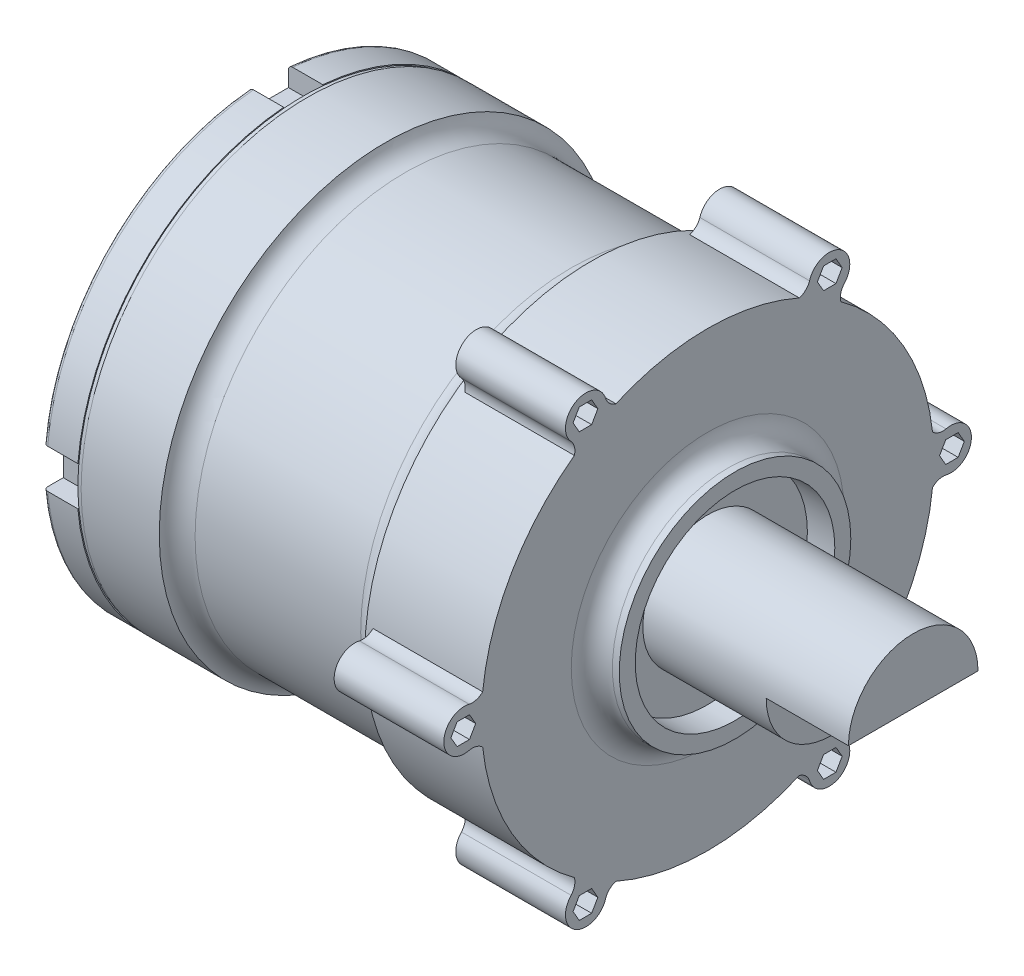
from build123d import *

# Parameters (mm, degrees)
SKETCH1_R            = 16.5
BOSS_EXTRUDE1_DEPTH  = 32
SKETCH2_W            = 2.99551857
SKETCH2_H            = 2.853303302
SKETCH2_W_2          = 2.853303302
SKETCH2_H_2          = 2.99551857
CUT_EXTRUDE1_DEPTH   = 2.5
SKETCH3_R            = 4
BOSS_EXTRUDE2_DEPTH  = 2.2
CUT_EXTRUDE2_DEPTH   = 12.2
SKETCH5_W            = 3.219111416
SKETCH5_H            = 1.024262723
BOSS_EXTRUDE3_DEPTH  = 3
CUT_EXTRUDE3_DEPTH   = 3
CIRPATTERN2_COUNT    = 2
SHELL1_START         = 2
SHELL1_DEPTH         = 30
SHELL1_START_2       = 14.2
SHELL1_2_DEPTH       = 17.8
SHELL1_START_3       = 4.5
SHELL1_3_DEPTH       = 9.7
SHELL1_START_4       = -0.2
SHELL1_4_OUTLINE_R   = 2
SHELL1_4_DEPTH       = 2.2
SKETCH7_R            = 9.780494134
CUT_EXTRUDE4_DEPTH   = 28
SKETCH8_R            = 16.5
SKETCH8_R_2          = 16.427034369
CUT_EXTRUDE5_DEPTH   = 0.3
FILLET1_R            = 0.3
FILLET2_R            = 0.8
BOSS_EXTRUDE5_START  = -25
SKETCH11_R           = 14.5
SKETCH11_R_2         = 4.725
BOSS_EXTRUDE5_DEPTH  = 25
SKETCH13_R           = 4.725
BOSS_EXTRUDE7_DEPTH  = 15
SKETCH15_R           = 8.446832145
SKETCH15_R_2         = 7.280611869
BOSS_EXTRUDE9_DEPTH  = 2
FILLET3_R            = 1.5
SKETCH16_R           = 17.509088537
SKETCH16_R_2         = 15.346804342
CUT_EXTRUDE6_DEPTH   = 7.5
FILLET4_R            = 1.5
CUT_EXTRUDE9_DEPTH   = 6
BOSS_EXTRUDE10_DEPTH = 8


# Read off the part's stored shape, not the designer's step: Shell1
with BuildPart() as part:
    # Sketch1 → Boss-Extrude1 (new body)
    with BuildSketch(Plane(origin=(0, 0, 0), x_dir=(0, 0, -1), z_dir=(1, 0, 0))):
        Circle(SKETCH1_R)
    extrude(amount=BOSS_EXTRUDE1_DEPTH)

    # Sketch2 → Cut-Extrude1 (cut)
    with BuildSketch(Plane.ZY):
        with Locations((-16.5, 0)):
            Rectangle(SKETCH2_W, SKETCH2_H)
        with Locations((0, 16.5)):
            Rectangle(SKETCH2_W_2, SKETCH2_H_2)
        with Locations((16.5, 0)):
            Rectangle(SKETCH2_W, SKETCH2_H)
        with Locations((0, -16.5)):
            Rectangle(SKETCH2_W_2, SKETCH2_H_2)
    extrude(amount=-CUT_EXTRUDE1_DEPTH, mode=Mode.SUBTRACT)

    # Sketch3 → Boss-Extrude2 (add)
    with BuildSketch(Plane.ZY):
        Circle(SKETCH3_R)
    extrude(amount=BOSS_EXTRUDE2_DEPTH)

    # Sketch4 → Cut-Extrude2 (cut)
    with BuildSketch(Plane.ZY):
        with BuildLine():
            ThreePointArc((2.706980055, 5.596864168), (0.036580812, 6.702979752), (-2.633818432, 5.596864168))
            ThreePointArc((-2.633818432, 5.596864168), (-2.633818432, 4.865247937), (-1.902202201, 4.865247937))
            ThreePointArc((-1.902202201, 4.865247937), (0.036580812, 5.668318155), (1.975363824, 4.865247937))
            ThreePointArc((1.975363824, 4.865247937), (2.706980055, 4.865247937), (2.706980055, 5.596864168))
        make_face()
        with BuildLine():
            ThreePointArc((-2.706980055, -5.596864168), (-0.036580812, -6.702979752), (2.633818432, -5.596864168))
            ThreePointArc((2.633818432, -5.596864168), (2.633818432, -4.865247937), (1.902202201, -4.865247937))
            ThreePointArc((1.902202201, -4.865247937), (-0.036580812, -5.668318155), (-1.975363824, -4.865247937))
            ThreePointArc((-1.975363824, -4.865247937), (-2.706980055, -4.865247937), (-2.706980055, -5.596864168))
        make_face()
    extrude(amount=-CUT_EXTRUDE2_DEPTH, mode=Mode.SUBTRACT)

    # Sketch5 → Boss-Extrude3 (add)
    with BuildSketch(Plane.ZY):
        with Locations((0, 11.230309148)):
            Rectangle(SKETCH5_W, SKETCH5_H)
    boss_extrude3 = extrude(amount=BOSS_EXTRUDE3_DEPTH)

    # Sketch6 → Cut-Extrude3 (cut)
    with BuildSketch(Plane(origin=(0, 11.742440509, 0), x_dir=(1, 0, 0), z_dir=(0, 1, 0))):
        with BuildLine():
            Line((-1.239883538, -0.443858464), (-2.275602474, -0.443858464))
            ThreePointArc((-2.275602474, -0.443858464), (-2.719460937, 0), (-2.275602474, 0.443858464))
            Line((-2.275602474, 0.443858464), (-1.239883538, 0.443858464))
            ThreePointArc((-1.239883538, 0.443858464), (-0.796025074, 0), (-1.239883538, -0.443858464))
        make_face()
    cut_extrude3 = extrude(amount=-CUT_EXTRUDE3_DEPTH, mode=Mode.SUBTRACT)

    # CirPattern2: Boss-Extrude3, Cut-Extrude3 ×2 about axis
    cirpattern2_axis = Axis((0, 0, 0), (1, 0, 0))
    add([boss_extrude3.rotate(cirpattern2_axis, i * 360 / CIRPATTERN2_COUNT) for i in range(1, CIRPATTERN2_COUNT)])
    add([cut_extrude3.rotate(cirpattern2_axis, i * 360 / CIRPATTERN2_COUNT) for i in range(1, CIRPATTERN2_COUNT)], mode=Mode.SUBTRACT)

    # Shell1 outline → Shell1 (cut)
    with BuildSketch(Plane.YZ.offset(SHELL1_START)):
        with BuildLine():
            Line((13.002240715, 3.426651651), (14.089288785, 3.426651651))
            ThreePointArc((14.089288785, 3.426651651), (10.253048327, 10.253048327), (3.426651651, 14.089288785))
            Line((3.426651651, 14.089288785), (3.426651651, 13.002240715))
            Line((3.426651651, 13.002240715), (-3.426651651, 13.002240715))
            Line((-3.426651651, 13.002240715), (-3.426651651, 14.089288785))
            ThreePointArc((-3.426651651, 14.089288785), (-10.253048327, 10.253048327), (-14.089288785, 3.426651651))
            Line((-14.089288785, 3.426651651), (-13.002240715, 3.426651651))
            Line((-13.002240715, 3.426651651), (-13.002240715, -3.426651651))
            Line((-13.002240715, -3.426651651), (-14.089288785, -3.426651651))
            ThreePointArc((-14.089288785, -3.426651651), (-10.253048327, -10.253048327), (-3.426651651, -14.089288785))
            Line((-3.426651651, -14.089288785), (-3.426651651, -13.002240715))
            Line((-3.426651651, -13.002240715), (3.426651651, -13.002240715))
            Line((3.426651651, -13.002240715), (3.426651651, -14.089288785))
            ThreePointArc((3.426651651, -14.089288785), (10.253048327, -10.253048327), (14.089288785, -3.426651651))
            Line((14.089288785, -3.426651651), (13.002240715, -3.426651651))
            Line((13.002240715, -3.426651651), (13.002240715, 3.426651651))
        make_face()
        with BuildLine():
            ThreePointArc((-3.451034375, 0.487988639), (-3.668318155, -0.036580811), (-3.451034375, -0.561150262))
            ThreePointArc((-3.451034375, -0.561150262), (-3.451034375, -4.121193617), (-7.01107773, -4.121193617))
            ThreePointArc((-7.01107773, -4.121193617), (-8.702979752, -0.036580811), (-7.01107773, 4.048031994))
            ThreePointArc((-7.01107773, 4.048031994), (-3.451034375, 4.048031994), (-3.451034375, 0.487988639))
        make_face(mode=Mode.SUBTRACT)
        with BuildLine():
            ThreePointArc((3.451034375, -0.487988639), (3.668318155, 0.036580811), (3.451034375, 0.561150262))
            ThreePointArc((3.451034375, 0.561150262), (3.451034375, 4.121193617), (7.01107773, 4.121193617))
            ThreePointArc((7.01107773, 4.121193617), (8.702979752, 0.036580811), (7.01107773, -4.048031994))
            ThreePointArc((7.01107773, -4.048031994), (3.451034375, -4.048031994), (3.451034375, -0.487988639))
        make_face(mode=Mode.SUBTRACT)
    extrude(amount=SHELL1_DEPTH, mode=Mode.SUBTRACT)

    # Shell1 2 outline → Shell1 2 (cut)
    with BuildSketch(Plane.YZ.offset(SHELL1_START_2)):
        with BuildLine():
            ThreePointArc((14.089288785, -3.426651651), (14.5, 0), (14.089288785, 3.426651651))
            Line((14.089288785, 3.426651651), (13.002240715, 3.426651651))
            Line((13.002240715, 3.426651651), (13.002240715, -3.426651651))
            Line((13.002240715, -3.426651651), (14.089288785, -3.426651651))
        make_face()
        with BuildLine():
            Line((3.426651651, 13.002240715), (3.426651651, 14.089288785))
            ThreePointArc((3.426651651, 14.089288785), (0, 14.5), (-3.426651651, 14.089288785))
            Line((-3.426651651, 14.089288785), (-3.426651651, 13.002240715))
            Line((-3.426651651, 13.002240715), (3.426651651, 13.002240715))
        make_face()
        with BuildLine():
            ThreePointArc((-3.426651651, -14.089288785), (0, -14.5), (3.426651651, -14.089288785))
            Line((3.426651651, -14.089288785), (3.426651651, -13.002240715))
            Line((3.426651651, -13.002240715), (-3.426651651, -13.002240715))
            Line((-3.426651651, -13.002240715), (-3.426651651, -14.089288785))
        make_face()
        with BuildLine():
            Line((-13.002240715, 3.426651651), (-14.089288785, 3.426651651))
            ThreePointArc((-14.089288785, 3.426651651), (-14.5, 0), (-14.089288785, -3.426651651))
            Line((-14.089288785, -3.426651651), (-13.002240715, -3.426651651))
            Line((-13.002240715, -3.426651651), (-13.002240715, 3.426651651))
        make_face()
        with BuildLine():
            ThreePointArc((-7.01107773, -4.121193617), (-3.451034375, -4.121193617), (-3.451034375, -0.561150262))
            ThreePointArc((-3.451034375, -0.561150262), (-3.668318155, -0.036580811), (-3.451034375, 0.487988639))
            ThreePointArc((-3.451034375, 0.487988639), (-3.451034375, 4.048031994), (-7.01107773, 4.048031994))
            ThreePointArc((-7.01107773, 4.048031994), (-8.702979752, -0.036580811), (-7.01107773, -4.121193617))
        make_face()
        with BuildLine():
            ThreePointArc((7.01107773, 4.121193617), (3.451034375, 4.121193617), (3.451034375, 0.561150262))
            ThreePointArc((3.451034375, 0.561150262), (3.668318155, 0.036580811), (3.451034375, -0.487988639))
            ThreePointArc((3.451034375, -0.487988639), (3.451034375, -4.048031994), (7.01107773, -4.048031994))
            ThreePointArc((7.01107773, -4.048031994), (8.702979752, 0.036580811), (7.01107773, 4.121193617))
        make_face()
    extrude(amount=SHELL1_2_DEPTH, mode=Mode.SUBTRACT)

    # Shell1 3 outline → Shell1 3 (cut)
    with BuildSketch(Plane.YZ.offset(SHELL1_START_3)):
        with BuildLine():
            ThreePointArc((14.089288785, -3.426651651), (14.5, 0), (14.089288785, 3.426651651))
            Line((14.089288785, 3.426651651), (13.002240715, 3.426651651))
            Line((13.002240715, 3.426651651), (13.002240715, -3.426651651))
            Line((13.002240715, -3.426651651), (14.089288785, -3.426651651))
        make_face()
        with BuildLine():
            Line((3.426651651, 13.002240715), (3.426651651, 14.089288785))
            ThreePointArc((3.426651651, 14.089288785), (0, 14.5), (-3.426651651, 14.089288785))
            Line((-3.426651651, 14.089288785), (-3.426651651, 13.002240715))
            Line((-3.426651651, 13.002240715), (3.426651651, 13.002240715))
        make_face()
        with BuildLine():
            ThreePointArc((-3.426651651, -14.089288785), (0, -14.5), (3.426651651, -14.089288785))
            Line((3.426651651, -14.089288785), (3.426651651, -13.002240715))
            Line((3.426651651, -13.002240715), (-3.426651651, -13.002240715))
            Line((-3.426651651, -13.002240715), (-3.426651651, -14.089288785))
        make_face()
        with BuildLine():
            Line((-13.002240715, 3.426651651), (-14.089288785, 3.426651651))
            ThreePointArc((-14.089288785, 3.426651651), (-14.5, 0), (-14.089288785, -3.426651651))
            Line((-14.089288785, -3.426651651), (-13.002240715, -3.426651651))
            Line((-13.002240715, -3.426651651), (-13.002240715, 3.426651651))
        make_face()
    extrude(amount=SHELL1_3_DEPTH, mode=Mode.SUBTRACT)

    # Shell1 4 outline → Shell1 4 (cut)
    with BuildSketch(Plane.YZ.offset(SHELL1_START_4)):
        Circle(SHELL1_4_OUTLINE_R)
    extrude(amount=SHELL1_4_DEPTH, mode=Mode.SUBTRACT)

    # Sketch7 → Cut-Extrude4 (cut)
    with BuildSketch(Plane(origin=(2, 0, 0), x_dir=(0, 0, -1), z_dir=(1, 0, 0))):
        Circle(SKETCH7_R)
    extrude(amount=CUT_EXTRUDE4_DEPTH, mode=Mode.SUBTRACT)

    # Sketch8 → Cut-Extrude5 (cut)
    with BuildSketch(Plane.ZY.offset(-2.5)):
        Circle(SKETCH8_R)
        Circle(SKETCH8_R_2, mode=Mode.SUBTRACT)
    extrude(amount=-CUT_EXTRUDE5_DEPTH, mode=Mode.SUBTRACT)

    # Fillet1
    fillet1_edges = [part.edges().sort_by_distance(p)[0] for p in [
        (0, 11.66726189, -11.66726189),
        (0, 11.66726189, 11.66726189),
        (0, -11.66726189, 11.66726189),
        (0, -11.66726189, -11.66726189),
    ]]
    fillet(fillet1_edges, radius=FILLET1_R)

    # Fillet2
    fillet2_edges = [part.edges().sort_by_distance(p)[0] for p in [
        (-3, 11.230309148, 1.609555708),
        (-3, 11.230309148, -1.609555708),
        (-3, -11.230309148, -1.609555708),
        (-3, -11.230309148, 1.609555708),
    ]]
    fillet(fillet2_edges, radius=FILLET2_R)

    # Sketch11 → Boss-Extrude5 (add)
    with BuildSketch(Plane(origin=(32, 0, 0), x_dir=(0, 0, -1), z_dir=(1, 0, 0)).offset(BOSS_EXTRUDE5_START)):
        with Locations(Location((0, 0, 0), (0, 0, 193.669492408))):
            Circle(SKETCH11_R)
        Circle(SKETCH11_R_2, mode=Mode.SUBTRACT)
    extrude(amount=BOSS_EXTRUDE5_DEPTH)

    # Sketch15 → Boss-Extrude9 (add)
    with BuildSketch(Plane(origin=(32, 0, 0), x_dir=(0, 0, -1), z_dir=(1, 0, 0))):
        Circle(SKETCH15_R)
        Circle(SKETCH15_R_2, mode=Mode.SUBTRACT)
    extrude(amount=BOSS_EXTRUDE9_DEPTH)

    # Fillet3
    fillet3_edges = [part.edges().sort_by_distance(p)[0] for p in [
        (32, 0, 8.446832145),
    ]]
    fillet(fillet3_edges, radius=FILLET3_R)

    # Sketch16 → Cut-Extrude6 (cut, symmetric)
    with BuildSketch(Plane.ZY.offset(-16)):
        Circle(SKETCH16_R)
        Circle(SKETCH16_R_2, mode=Mode.SUBTRACT)
    extrude(amount=CUT_EXTRUDE6_DEPTH, both=True, mode=Mode.SUBTRACT)

    # Fillet4
    # the kernel refuses this fillet: 1.5 mm, written as the material it adds along each edge
    with BuildSketch(Plane(origin=(23.5, 0, 0), x_dir=(0, 0, 1), z_dir=(0, -1, 0))) as fillet4_piece_1:
        with BuildLine():
            CenterArc((16.846804342, 1.459358334), FILLET4_R, 180, 76.632098471)
            Line((15.346804342, 1.459358334), (15.316804342, 1.459358334))
            Line((15.316804342, 1.459358334), (15.316804342, 0))
            Line((15.316804342, 0), (15.346804342, -0.03))
            ThreePointArc((15.346804342, -0.03), (15.923402171, -0.03), (16.493063913, -0.029187167))
            Line((16.493063913, -0.029187167), (16.5, 0))
        make_face()
    revolve(axis=Axis((23.5, 0, 0), (-1, 0, 0)))
    with BuildSketch(Plane(origin=(8.5, 0, 0), x_dir=(0, 0, 1), z_dir=(0, -1, 0))) as fillet4_piece_2:
        with BuildLine():
            CenterArc((16.846804342, -1.459358334), FILLET4_R, 103.367901529, 76.632098471)
            Line((16.5, 0), (16.493063913, 0.029187167))
            ThreePointArc((16.493063913, 0.029187167), (15.923402171, 0.03), (15.346804342, 0.03))
            Line((15.346804342, 0.03), (15.316804342, 0))
            Line((15.316804342, 0), (15.316804342, -1.459358334))
            Line((15.316804342, -1.459358334), (15.346804342, -1.459358334))
        make_face()
    revolve(axis=Axis((8.5, 0, 0), (-1, 0, 0)))

    # Sketch19 → Boss-Extrude10 (add)
    # profile 1 of 6: a face of its own
    with BuildSketch(Plane(origin=(32, 0, 0), x_dir=(0, 0, -1), z_dir=(1, 0, 0))):
        with BuildLine():
            ThreePointArc((9.981726294, 12.862414051), (8.141983437, 14.099101416), (6.151302641, 15.074416434))
            ThreePointArc((6.151302641, 15.074416434), (6.932911643, 15.183064398), (7.436427865, 15.790673174))
            ThreePointArc((7.436427865, 15.790673174), (9.623178755, 16.666102484), (9.958410179, 14.334606007))
            ThreePointArc((9.958410179, 14.334606007), (9.683975499, 13.593978981), (9.981726294, 12.862414051))
        make_face()
        Polygon((8.460537685, 14.652349079), (9.364516399, 14.652349079), (9.816505756, 15.43521761), (9.364516399, 16.218086141), (8.460537685, 16.218086141), (8.008548328, 15.43521761), align=None, mode=Mode.SUBTRACT)
    # profile 2 of 6: a face of its own
    with BuildSketch(Plane(origin=(32, 0, 0), x_dir=(0, 0, -1), z_dir=(1, 0, 0))):
        with BuildLine():
            ThreePointArc((17.393838044, 1.456067168), (19.245357511, 0), (17.393838044, -1.456067168))
            ThreePointArc((17.393838044, -1.456067168), (16.614152399, -1.589352567), (16.129832137, -2.214739318))
            ThreePointArc((16.129832137, -2.214739318), (16.281171795, 0), (16.129832137, 2.214739318))
            ThreePointArc((16.129832137, 2.214739318), (16.614152399, 1.589352567), (17.393838044, 1.456067168))
        make_face()
        Polygon((16.92007537, 0), (17.372064727, -0.782868531), (18.276043441, -0.782868531), (18.728032798, 0), (18.276043441, 0.782868531), (17.372064727, 0.782868531), align=None, mode=Mode.SUBTRACT)
    # profile 3 of 6: a face of its own
    with BuildSketch(Plane(origin=(32, 0, 0), x_dir=(0, 0, -1), z_dir=(1, 0, 0))):
        with BuildLine():
            ThreePointArc((6.151302641, -15.074416434), (6.932911643, -15.183064398), (7.436427865, -15.790673174))
            ThreePointArc((7.436427865, -15.790673174), (9.623178755, -16.666102484), (9.958410179, -14.334606007))
            ThreePointArc((9.958410179, -14.334606007), (9.683975499, -13.593978981), (9.981726294, -12.862414051))
            ThreePointArc((9.981726294, -12.862414051), (8.141983437, -14.099101416), (6.151302641, -15.074416434))
        make_face()
        Polygon((8.460537685, -14.652349079), (8.008548328, -15.43521761), (8.460537685, -16.218086141), (9.364516399, -16.218086141), (9.816505756, -15.43521761), (9.364516399, -14.652349079), align=None, mode=Mode.SUBTRACT)
    # profile 4 of 6: a face of its own
    with BuildSketch(Plane(origin=(32, 0, 0), x_dir=(0, 0, -1), z_dir=(1, 0, 0))):
        with BuildLine():
            ThreePointArc((-9.974378203, -12.86811309), (-9.68192062, -13.597886323), (-9.956410179, -14.334606007))
            ThreePointArc((-9.956410179, -14.334606007), (-9.621178755, -16.666102484), (-7.434427865, -15.790673174))
            ThreePointArc((-7.434427865, -15.790673174), (-6.933014687, -15.184239564), (-6.153993963, -15.073317927))
            ThreePointArc((-6.153993963, -15.073317927), (-8.139215519, -14.100699477), (-9.974378203, -12.86811309))
        make_face()
        Polygon((-8.458537685, -14.652349079), (-9.362516399, -14.652349079), (-9.814505756, -15.43521761), (-9.362516399, -16.218086141), (-8.458537685, -16.218086141), (-8.006548328, -15.43521761), align=None, mode=Mode.SUBTRACT)
    # profile 5 of 6: a face of its own
    with BuildSketch(Plane(origin=(32, 0, 0), x_dir=(0, 0, -1), z_dir=(1, 0, 0))):
        with BuildLine():
            ThreePointArc((-16.131488909, 2.202639463), (-16.617580825, 1.586115726), (-17.391838044, 1.456067168))
            ThreePointArc((-17.391838044, 1.456067168), (-19.243357511, 0), (-17.391838044, -1.456067168))
            ThreePointArc((-17.391838044, -1.456067168), (-16.617580825, -1.586115726), (-16.131488909, -2.202639463))
            ThreePointArc((-16.131488909, -2.202639463), (-16.281171795, 0), (-16.131488909, 2.202639463))
        make_face()
        Polygon((-16.91807537, 0), (-17.370064727, 0.782868531), (-18.274043441, 0.782868531), (-18.726032798, 0), (-18.274043441, -0.782868531), (-17.370064727, -0.782868531), align=None, mode=Mode.SUBTRACT)
    # profile 6 of 6: a face of its own
    with BuildSketch(Plane(origin=(32, 0, 0), x_dir=(0, 0, -1), z_dir=(1, 0, 0))):
        with BuildLine():
            ThreePointArc((-6.153993963, 15.073317927), (-6.933014687, 15.184239564), (-7.434427865, 15.790673174))
            ThreePointArc((-7.434427865, 15.790673174), (-9.621178755, 16.666102484), (-9.956410179, 14.334606007))
            ThreePointArc((-9.956410179, 14.334606007), (-9.68192062, 13.597886323), (-9.974378203, 12.86811309))
            ThreePointArc((-9.974378203, 12.86811309), (-8.139215519, 14.100699477), (-6.153993963, 15.073317927))
        make_face()
        Polygon((-8.458537685, 14.652349079), (-8.006548328, 15.43521761), (-8.458537685, 16.218086141), (-9.362516399, 16.218086141), (-9.814505756, 15.43521761), (-9.362516399, 14.652349079), align=None, mode=Mode.SUBTRACT)
    extrude(amount=-BOSS_EXTRUDE10_DEPTH)


with BuildPart() as body_2:
    # Sketch13 → Boss-Extrude7 (new body)
    with BuildSketch(Plane(origin=(32, 0, 0), x_dir=(0, 0, -1), z_dir=(1, 0, 0))):
        Circle(SKETCH13_R)
    extrude(amount=BOSS_EXTRUDE7_DEPTH)

    # Sketch18 → Cut-Extrude9 (cut)
    with BuildSketch(Plane(origin=(47, 0, 0), x_dir=(0, 0, -1), z_dir=(1, 0, 0))):
        Polygon((5.399350286, 0), (-5.57858183, 0), (-5.57858183, -4.678325977), (5.399350286, -5.466562115), align=None)
    extrude(amount=-CUT_EXTRUDE9_DEPTH, mode=Mode.SUBTRACT)


solid = Compound([part.part, body_2.part])
